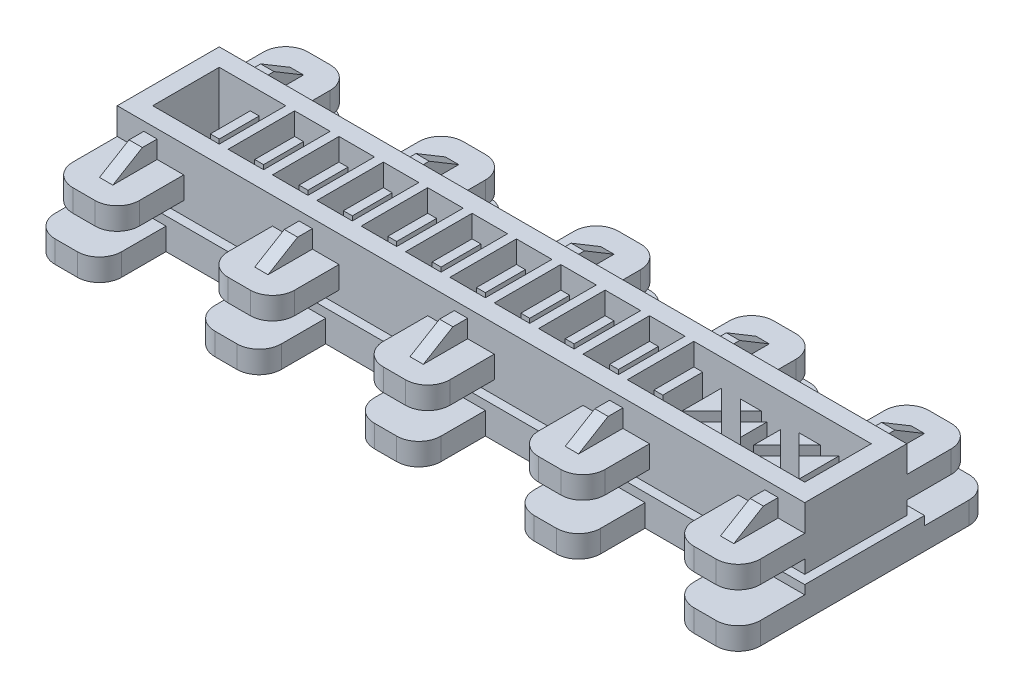
from build123d import *
from OCP.BRepFilletAPI import BRepFilletAPI_MakeChamfer

# Parameters (mm, degrees)
SKETCH1_W                       = 8
SKETCH1_H                       = 15
FIRST_CHAMBER_BLOCK_DEPTH       = 15
SKETCH2_W                       = 2
SKETCH2_H                       = 9
FIRST_CHAMBER_CAVITY_DEPTH      = 13
SKETCH3_W                       = 15
SKETCH3_H                       = 3
CHAMBER_SPACER_DEPTH            = 2
PATTERN_CHAMBERS_COUNT          = 11
PATTERN_CHAMBERS_PITCH          = 10
SKETCH4_W                       = 15
SKETCH4_H                       = 12
THICKEN_END_1_DEPTH             = 2
SKETCH5_W                       = 15
SKETCH5_H                       = 15
THICKEN_END_2_DEPTH             = 2
SKETCH6_W                       = 98
SKETCH6_H                       = 2
CENTRAL_AIR_CHANNEL_DEPTH       = 2
SKETCH17_W                      = 15
SKETCH17_H                      = 15
BOSS_EXTRUDE1_DEPTH             = 30
SKETCH18_W                      = 15
SKETCH18_H                      = 15
BOSS_EXTRUDE2_DEPTH             = 5
CUT_EXTRUDE1_DEPTH              = 12
SKETCH20_W                      = 6
SKETCH20_H                      = 2
SKETCH20_W_2                    = 3.257359313
SKETCH20_R                      = 1
NIPPLE_EXTRUDE_DEPTH            = 2
SKETCH10_W                      = 155
SKETCH10_H                      = 23
ENCASING_BLOCK_DEPTH            = 21
SPLIT_MOLD_OUTLINE_W            = 155
SPLIT_MOLD_OUTLINE_H            = 23
SPLIT_MOLD_OUTLINE_W_2          = 147
SPLIT_MOLD_OUTLINE_H_2          = 15
SPLIT_MOLD_DEPTH                = 15
SPLIT_START                     = 3
SPLIT_MOLD_2_OUTLINE_W          = 2
SPLIT_MOLD_2_OUTLINE_H          = 15
SPLIT_MOLD_2_DEPTH              = 12
SPLIT_MOLD_3_OUTLINE_W          = 155
SPLIT_MOLD_3_OUTLINE_H          = 23
SPLIT_MOLD_3_OUTLINE_W_2        = 147
SPLIT_MOLD_3_OUTLINE_H_2        = 15
SPLIT_MOLD_3_DEPTH              = 15
SPLIT_MOLD_4_OUTLINE_W          = 2
SPLIT_MOLD_4_OUTLINE_H          = 15
SPLIT_MOLD_4_DEPTH              = 12
SKETCH11_W                      = 15
SKETCH11_H                      = 5
GRIP_TAB_1_DEPTH                = 15
VERRUNDUNG1_R                   = 5
SKETCH13_W                      = 159
SKETCH13_H                      = 27
SKETCH13_W_2                    = 155
SKETCH13_H_2                    = 23
BASE_MOLD_LIP_DEPTH             = 7
SKETCH14_W                      = 15
SKETCH14_H                      = 5
BASE_GRIP_TABS_1_AND_2_DEPTH    = 15
SKETCH16_W                      = 15
SKETCH16_H                      = 5
BASE_GRIP_TABS_3_AND_4_DEPTH    = 15
FILLET_BASE_GRIP_TABS_R         = 5
SKIZZE1_W                       = 3
SKIZZE1_H                       = 6
AUFSATZ_LINEAR_AUSTRAGEN1_DEPTH = 10
FASE1_SIZE                      = 10
FASE1_SIZE_2                    = 6
FASE2_SIZE                      = 10
FASE2_SIZE_2                    = 6
SKIZZE2_W                       = 5
SKIZZE2_H                       = 2
SCHNITT_LINEAR_AUSTRAGEN1_DEPTH = 162.77144371


# Read off the part's stored shape, not the designer's step: split mold
with BuildPart() as part:
    # Sketch1 → first chamber block (new body)
    with BuildSketch(Plane.XY):
        with Locations((4, 7.5)):
            Rectangle(SKETCH1_W, SKETCH1_H)
    extrude(amount=FIRST_CHAMBER_BLOCK_DEPTH)

    # Sketch2 → first chamber cavity (cut)
    with BuildSketch(Plane.XZ):
        with Locations((4, 7.5)):
            Rectangle(SKETCH2_W, SKETCH2_H)
    extrude(amount=-FIRST_CHAMBER_CAVITY_DEPTH, mode=Mode.SUBTRACT)

    # Sketch3 → chamber spacer (add)
    with BuildSketch(Plane(origin=(8, 0, 0), x_dir=(0, 0, -1), z_dir=(1, 0, 0))):
        with Locations((-7.5, 1.5)):
            Rectangle(SKETCH3_W, SKETCH3_H)
    extrude(amount=CHAMBER_SPACER_DEPTH)


with BuildPart() as pattern_chambers_1:
    # pattern chambers: pattern copy
    add(part.part.moved(Location(Vector(1, 0, 0) * (1 * PATTERN_CHAMBERS_PITCH))))


with BuildPart() as pattern_chambers_2:
    # pattern chambers: pattern copy
    add(part.part.moved(Location(Vector(1, 0, 0) * (2 * PATTERN_CHAMBERS_PITCH))))


with BuildPart() as pattern_chambers_3:
    # pattern chambers: pattern copy
    add(part.part.moved(Location(Vector(1, 0, 0) * (3 * PATTERN_CHAMBERS_PITCH))))


with BuildPart() as pattern_chambers_4:
    # pattern chambers: pattern copy
    add(part.part.moved(Location(Vector(1, 0, 0) * (4 * PATTERN_CHAMBERS_PITCH))))


with BuildPart() as pattern_chambers_5:
    # pattern chambers: pattern copy
    add(part.part.moved(Location(Vector(1, 0, 0) * (5 * PATTERN_CHAMBERS_PITCH))))


with BuildPart() as pattern_chambers_6:
    # pattern chambers: pattern copy
    add(part.part.moved(Location(Vector(1, 0, 0) * (6 * PATTERN_CHAMBERS_PITCH))))


with BuildPart() as pattern_chambers_7:
    # pattern chambers: pattern copy
    add(part.part.moved(Location(Vector(1, 0, 0) * (7 * PATTERN_CHAMBERS_PITCH))))


with BuildPart() as pattern_chambers_8:
    # pattern chambers: pattern copy
    add(part.part.moved(Location(Vector(1, 0, 0) * (8 * PATTERN_CHAMBERS_PITCH))))


with BuildPart() as pattern_chambers_9:
    # pattern chambers: pattern copy
    add(part.part.moved(Location(Vector(1, 0, 0) * (9 * PATTERN_CHAMBERS_PITCH))))


with BuildPart() as pattern_chambers_10:
    # pattern chambers: pattern copy
    add(part.part.moved(Location(Vector(1, 0, 0) * (10 * PATTERN_CHAMBERS_PITCH))))

    # combine into 1 solid body: union pattern chambers_9, pattern chambers_8, pattern chambers_7, pattern chambers_6, pattern chambers_5, pattern chambers_4, pattern chambers_3, pattern chambers_2, pattern chambers_1, part
    add(pattern_chambers_9.part)
    add(pattern_chambers_8.part)
    add(pattern_chambers_7.part)
    add(pattern_chambers_6.part)
    add(pattern_chambers_5.part)
    add(pattern_chambers_4.part)
    add(pattern_chambers_3.part)
    add(pattern_chambers_2.part)
    add(pattern_chambers_1.part)
    add(part.part)

    # Sketch4 → thicken end 1 (add)
    with BuildSketch(Plane(origin=(108, 0, 0), x_dir=(0, 0, -1), z_dir=(1, 0, 0))):
        with Locations((-7.5, 9)):
            Rectangle(SKETCH4_W, SKETCH4_H)
    extrude(amount=THICKEN_END_1_DEPTH)

    # Sketch5 → thicken end 2 (add)
    with BuildSketch(Plane.ZY):
        with Locations((7.5, 7.5)):
            Rectangle(SKETCH5_W, SKETCH5_H)
    extrude(amount=THICKEN_END_2_DEPTH)

    # Sketch6 → central air channel (cut)
    with BuildSketch(Plane.XZ):
        with Locations((54, 7.5)):
            Rectangle(SKETCH6_W, SKETCH6_H)
    extrude(amount=-CENTRAL_AIR_CHANNEL_DEPTH, mode=Mode.SUBTRACT)

    # Sketch17 → Boss-Extrude1 (add)
    with BuildSketch(Plane(origin=(110, 0, 0), x_dir=(0, 0, -1), z_dir=(1, 0, 0))):
        with Locations((-7.5, 7.5)):
            Rectangle(SKETCH17_W, SKETCH17_H)
    extrude(amount=BOSS_EXTRUDE1_DEPTH)

    # Sketch18 → Boss-Extrude2 (add)
    with BuildSketch(Plane.ZY.offset(2)):
        with Locations((7.5, 7.5)):
            Rectangle(SKETCH18_W, SKETCH18_H)
    extrude(amount=BOSS_EXTRUDE2_DEPTH)

    # Sketch19 → Cut-Extrude1 (cut)
    with BuildSketch(Plane.XZ):
        Polygon((131.242640687, 7.5), (135.742640687, 3), (135.742640687, 12), align=None)
        Polygon((126.742640687, 3), (131.5, 3), (129.121320344, 5.378679656), align=None)
        Polygon((129.121320344, 9.621320344), (131.5, 12), (126.742640687, 12), align=None)
        Polygon((113.5, 3), (118.257359313, 3), (115.878679656, 5.378679656), align=None)
        Polygon((118, 7.5), (121, 4.5), (121, 10.5), align=None)
        Polygon((124, 10.5), (124, 4.5), (127, 7.5), align=None)
        Polygon((115.878679656, 9.621320344), (118.257359313, 12), (113.5, 12), align=None)
        Polygon((109.257359313, 12), (109.257359313, 3), (113.757359313, 7.5), align=None)
    extrude(amount=-CUT_EXTRUDE1_DEPTH, mode=Mode.SUBTRACT)

    # Sketch20 → nipple_extrude (add)
    with BuildSketch(Plane.XZ):
        Polygon((-6, 13), (-5, 13), (5, 13), (15, 13), (25, 13), (35, 13), (45, 13), (55, 13), (65, 13), (75, 13), (85, 13), (128, 13), (138, 13), (139, 13), (139, 14), (-6, 14), align=None)
        Polygon((-5, 2), (-5, 13), (-6, 13), (-6, 1), (139, 1), (139, 13), (138, 13), (138, 2), align=None)
        with Locations((-1, 10.5)):
            Rectangle(SKETCH20_W, SKETCH20_H)
        with Locations((-1, 4.5)):
            Rectangle(SKETCH20_W, SKETCH20_H)
        with Locations((9, 10.5)):
            Rectangle(SKETCH20_W, SKETCH20_H)
        with Locations((9, 4.5)):
            Rectangle(SKETCH20_W, SKETCH20_H)
        with Locations((19, 10.5)):
            Rectangle(SKETCH20_W, SKETCH20_H)
        with Locations((19, 4.5)):
            Rectangle(SKETCH20_W, SKETCH20_H)
        with Locations((29, 4.5)):
            Rectangle(SKETCH20_W, SKETCH20_H)
        with Locations((29, 10.5)):
            Rectangle(SKETCH20_W, SKETCH20_H)
        with Locations((39, 10.5)):
            Rectangle(SKETCH20_W, SKETCH20_H)
        with Locations((39, 4.5)):
            Rectangle(SKETCH20_W, SKETCH20_H)
        with Locations((49, 10.5)):
            Rectangle(SKETCH20_W, SKETCH20_H)
        with Locations((49, 4.5)):
            Rectangle(SKETCH20_W, SKETCH20_H)
        with Locations((59, 4.5)):
            Rectangle(SKETCH20_W, SKETCH20_H)
        with Locations((59, 10.5)):
            Rectangle(SKETCH20_W, SKETCH20_H)
        with Locations((69, 10.5)):
            Rectangle(SKETCH20_W, SKETCH20_H)
        with Locations((69, 4.5)):
            Rectangle(SKETCH20_W, SKETCH20_H)
        with Locations((79, 10.5)):
            Rectangle(SKETCH20_W, SKETCH20_H)
        with Locations((79, 4.5)):
            Rectangle(SKETCH20_W, SKETCH20_H)
        with Locations((89, 10.5)):
            Rectangle(SKETCH20_W, SKETCH20_H)
        with Locations((89, 4.5)):
            Rectangle(SKETCH20_W, SKETCH20_H)
        with Locations((99, 10.5)):
            Rectangle(SKETCH20_W, SKETCH20_H)
        with Locations((99, 4.5)):
            Rectangle(SKETCH20_W, SKETCH20_H)
        with Locations((107.128679656, 4.5)):
            Rectangle(SKETCH20_W_2, SKETCH20_H)
        with Locations((107.128679656, 10.5)):
            Rectangle(SKETCH20_W_2, SKETCH20_H)
        with Locations(Location((115.878679656, 7.5, 0), (0, 0, 90))):
            Circle(SKETCH20_R)
        with Locations(Location((129.121320344, 7.5, 0), (0, 0, 90))):
            Circle(SKETCH20_R)
    extrude(amount=NIPPLE_EXTRUDE_DEPTH)


with BuildPart() as body_2:
    # Sketch10 → encasing block (new body)
    with BuildSketch(Plane(origin=(0, 15, 0), x_dir=(1, 0, 0), z_dir=(0, 1, 0))):
        with Locations((66.5, -7.5)):
            Rectangle(SKETCH10_W, SKETCH10_H)
    extrude(amount=-ENCASING_BLOCK_DEPTH)

    # subtract actuator: cut pattern chambers_10
    add(pattern_chambers_10.part, mode=Mode.SUBTRACT)

    # split mold 3 outline → split mold 3 (cut)
    with BuildSketch(Plane(origin=(0, 0, 0), x_dir=(1, 0, 0), z_dir=(0, 1, 0))):
        with Locations((66.5, -7.5)):
            Rectangle(SPLIT_MOLD_3_OUTLINE_W, SPLIT_MOLD_3_OUTLINE_H)
        with Locations((66.5, -7.5)):
            Rectangle(SPLIT_MOLD_3_OUTLINE_W_2, SPLIT_MOLD_3_OUTLINE_H_2, mode=Mode.SUBTRACT)
    extrude(amount=SPLIT_MOLD_3_DEPTH, mode=Mode.SUBTRACT)

    # split mold 4 outline → split mold 4 (cut)
    with BuildSketch(Plane(origin=(0, 0, 0), x_dir=(1, 0, 0), z_dir=(0, 1, 0)).offset(SPLIT_START)):
        with Locations((99, -7.5)):
            Rectangle(SPLIT_MOLD_4_OUTLINE_W, SPLIT_MOLD_4_OUTLINE_H)
        with Locations((89, -7.5)):
            Rectangle(SPLIT_MOLD_4_OUTLINE_W, SPLIT_MOLD_4_OUTLINE_H)
        with Locations((79, -7.5)):
            Rectangle(SPLIT_MOLD_4_OUTLINE_W, SPLIT_MOLD_4_OUTLINE_H)
        with Locations((69, -7.5)):
            Rectangle(SPLIT_MOLD_4_OUTLINE_W, SPLIT_MOLD_4_OUTLINE_H)
        with Locations((59, -7.5)):
            Rectangle(SPLIT_MOLD_4_OUTLINE_W, SPLIT_MOLD_4_OUTLINE_H)
        with Locations((49, -7.5)):
            Rectangle(SPLIT_MOLD_4_OUTLINE_W, SPLIT_MOLD_4_OUTLINE_H)
        with Locations((39, -7.5)):
            Rectangle(SPLIT_MOLD_4_OUTLINE_W, SPLIT_MOLD_4_OUTLINE_H)
        with Locations((29, -7.5)):
            Rectangle(SPLIT_MOLD_4_OUTLINE_W, SPLIT_MOLD_4_OUTLINE_H)
        with Locations((19, -7.5)):
            Rectangle(SPLIT_MOLD_4_OUTLINE_W, SPLIT_MOLD_4_OUTLINE_H)
        with Locations((9, -7.5)):
            Rectangle(SPLIT_MOLD_4_OUTLINE_W, SPLIT_MOLD_4_OUTLINE_H)
    extrude(amount=SPLIT_MOLD_4_DEPTH, mode=Mode.SUBTRACT)

    # Sketch13 → base mold lip (add)
    with BuildSketch(Plane.XZ.offset(6)):
        with Locations((66.5, 7.5)):
            Rectangle(SKETCH13_W, SKETCH13_H)
        with Locations((66.5, 7.5)):
            Rectangle(SKETCH13_W_2, SKETCH13_H_2, mode=Mode.SUBTRACT)
    extrude(amount=-BASE_MOLD_LIP_DEPTH)

    # Sketch14 → base grip tabs 1 and 2 (add)
    with BuildSketch(Plane.XY.offset(21)):
        with Locations((-5.5, -3.5)):
            Rectangle(SKETCH14_W, SKETCH14_H)
        with Locations((138.5, -3.5)):
            Rectangle(SKETCH14_W, SKETCH14_H)
        with Locations((66.5, -3.5)):
            Rectangle(SKETCH14_W, SKETCH14_H)
        with Locations((102.5, -3.5)):
            Rectangle(SKETCH14_W, SKETCH14_H)
        with Locations((30.5, -3.5)):
            Rectangle(SKETCH14_W, SKETCH14_H)
    extrude(amount=BASE_GRIP_TABS_1_AND_2_DEPTH)

    # Sketch16 → base grip tabs 3 and 4 (add)
    with BuildSketch(Plane(origin=(0, 0, -6), x_dir=(-1, 0, 0), z_dir=(0, 0, -1))):
        with Locations((-138.5, -3.5)):
            Rectangle(SKETCH16_W, SKETCH16_H)
        with Locations((5.5, -3.5)):
            Rectangle(SKETCH16_W, SKETCH16_H)
        with Locations((-66.5, -3.5)):
            Rectangle(SKETCH16_W, SKETCH16_H)
        with Locations((-102.5, -3.5)):
            Rectangle(SKETCH16_W, SKETCH16_H)
        with Locations((-30.5, -3.5)):
            Rectangle(SKETCH16_W, SKETCH16_H)
    extrude(amount=BASE_GRIP_TABS_3_AND_4_DEPTH)

    # fillet base grip tabs
    fillet_base_grip_tabs_edges = [body_2.edges().sort_by_distance(p)[0] for p in [
        (146, -3.5, -21),
        (131, -3.5, -21),
        (2, -3.5, -21),
        (-13, -3.5, -21),
        (146, -3.5, 36),
        (131, -3.5, 36),
        (2, -3.5, 36),
        (-13, -3.5, 36),
        (59, -3.5, 36),
        (74, -3.5, 36),
        (59, -3.5, -21),
        (74, -3.5, -21),
        (95, -3.5, 36),
        (110, -3.5, 36),
        (23, -3.5, 36),
        (38, -3.5, 36),
        (23, -3.5, -21),
        (38, -3.5, -21),
        (95, -3.5, -21),
        (110, -3.5, -21),
    ]]
    fillet(fillet_base_grip_tabs_edges, radius=FILLET_BASE_GRIP_TABS_R)


with BuildPart() as body_2_2:
    # split mold outline → split mold (new body)
    with BuildSketch(Plane(origin=(0, 0, 0), x_dir=(1, 0, 0), z_dir=(0, 1, 0))):
        with Locations((66.5, -7.5)):
            Rectangle(SPLIT_MOLD_OUTLINE_W, SPLIT_MOLD_OUTLINE_H)
        with Locations((66.5, -7.5)):
            Rectangle(SPLIT_MOLD_OUTLINE_W_2, SPLIT_MOLD_OUTLINE_H_2, mode=Mode.SUBTRACT)
    extrude(amount=SPLIT_MOLD_DEPTH)

    # split mold 2 outline → split mold 2 (add)
    with BuildSketch(Plane(origin=(0, 0, 0), x_dir=(1, 0, 0), z_dir=(0, 1, 0)).offset(SPLIT_START)):
        with Locations((99, -7.5)):
            Rectangle(SPLIT_MOLD_2_OUTLINE_W, SPLIT_MOLD_2_OUTLINE_H)
        with Locations((89, -7.5)):
            Rectangle(SPLIT_MOLD_2_OUTLINE_W, SPLIT_MOLD_2_OUTLINE_H)
        with Locations((79, -7.5)):
            Rectangle(SPLIT_MOLD_2_OUTLINE_W, SPLIT_MOLD_2_OUTLINE_H)
        with Locations((69, -7.5)):
            Rectangle(SPLIT_MOLD_2_OUTLINE_W, SPLIT_MOLD_2_OUTLINE_H)
        with Locations((59, -7.5)):
            Rectangle(SPLIT_MOLD_2_OUTLINE_W, SPLIT_MOLD_2_OUTLINE_H)
        with Locations((49, -7.5)):
            Rectangle(SPLIT_MOLD_2_OUTLINE_W, SPLIT_MOLD_2_OUTLINE_H)
        with Locations((39, -7.5)):
            Rectangle(SPLIT_MOLD_2_OUTLINE_W, SPLIT_MOLD_2_OUTLINE_H)
        with Locations((29, -7.5)):
            Rectangle(SPLIT_MOLD_2_OUTLINE_W, SPLIT_MOLD_2_OUTLINE_H)
        with Locations((19, -7.5)):
            Rectangle(SPLIT_MOLD_2_OUTLINE_W, SPLIT_MOLD_2_OUTLINE_H)
        with Locations((9, -7.5)):
            Rectangle(SPLIT_MOLD_2_OUTLINE_W, SPLIT_MOLD_2_OUTLINE_H)
    extrude(amount=SPLIT_MOLD_2_DEPTH)

    # Sketch11 → grip tab 1 (add)
    with BuildSketch(Plane.XY.offset(19)):
        with Locations((-3.5, 6.5)):
            Rectangle(SKETCH11_W, SKETCH11_H)
        with Locations((66.5, 6.5)):
            Rectangle(SKETCH11_W, SKETCH11_H)
        with Locations((136.5, 6.5)):
            Rectangle(SKETCH11_W, SKETCH11_H)
        with Locations((31.5, 6.5)):
            Rectangle(SKETCH11_W, SKETCH11_H)
        with Locations((101.5, 6.5)):
            Rectangle(SKETCH11_W, SKETCH11_H)
    grip_tab_1 = extrude(amount=GRIP_TAB_1_DEPTH)

    # Spiegeln1: grip tab 1 across plane
    add(grip_tab_1.mirror(Plane.XY.offset(7.5)))

    # Verrundung1
    verrundung1_edges = [body_2_2.edges().sort_by_distance(p)[0] for p in [
        (-11, 6.5, -19),
        (4, 6.5, -19),
        (59, 6.5, -19),
        (74, 6.5, -19),
        (129, 6.5, -19),
        (144, 6.5, -19),
        (144, 6.5, 34),
        (129, 6.5, 34),
        (74, 6.5, 34),
        (59, 6.5, 34),
        (4, 6.5, 34),
        (-11, 6.5, 34),
        (109, 6.5, -19),
        (39, 6.5, -19),
        (24, 6.5, -19),
        (94, 6.5, -19),
        (109, 6.5, 34),
        (94, 6.5, 34),
        (39, 6.5, 34),
        (24, 6.5, 34),
    ]]
    fillet(verrundung1_edges, radius=VERRUNDUNG1_R)

    # Skizze1 → Aufsatz-Linear austragen1 (add)
    with BuildSketch(Plane.XY.offset(19)):
        with Locations((-3.5, 12)):
            Rectangle(SKIZZE1_W, SKIZZE1_H)
        with Locations((66.5, 12)):
            Rectangle(SKIZZE1_W, SKIZZE1_H)
        with Locations((136.5, 12)):
            Rectangle(SKIZZE1_W, SKIZZE1_H)
        with Locations((101.5, 12)):
            Rectangle(SKIZZE1_W, SKIZZE1_H)
        with Locations((31.5, 12)):
            Rectangle(SKIZZE1_W, SKIZZE1_H)
    aufsatz_linear_austragen1 = extrude(amount=AUFSATZ_LINEAR_AUSTRAGEN1_DEPTH)

    # Spiegeln2: Aufsatz-Linear austragen1 across plane
    add(aufsatz_linear_austragen1.mirror(Plane.XY.offset(7.5)))

    # Fase1
    fase1_edges_1 = [body_2_2.edges().sort_by_distance(p)[0] for p in [
        (-3.5, 15, 29),
    ]]
    fase1_side_1 = [body_2_2.faces().sort_by_distance(p)[0] for p in [
        (-3.5, 15, 28.88),
    ]]
    fase1_edges_2 = [body_2_2.edges().sort_by_distance(p)[0] for p in [
        (136.5, 15, 29),
    ]]
    fase1_side_2 = [body_2_2.faces().sort_by_distance(p)[0] for p in [
        (136.5, 15, 28.88),
    ]]
    fase1_edges_3 = [body_2_2.edges().sort_by_distance(p)[0] for p in [
        (66.5, 15, 29),
    ]]
    fase1_side_3 = [body_2_2.faces().sort_by_distance(p)[0] for p in [
        (66.5, 15, 28.88),
    ]]
    fase1_edges_4 = [body_2_2.edges().sort_by_distance(p)[0] for p in [
        (101.5, 15, 29),
    ]]
    fase1_side_4 = [body_2_2.faces().sort_by_distance(p)[0] for p in [
        (101.5, 15, 28.88),
    ]]
    fase1_edges_5 = [body_2_2.edges().sort_by_distance(p)[0] for p in [
        (31.5, 15, 29),
    ]]
    fase1_side_5 = [body_2_2.faces().sort_by_distance(p)[0] for p in [
        (31.5, 15, 28.88),
    ]]
    fase1 = BRepFilletAPI_MakeChamfer(body_2_2.part.solid().wrapped)
    for e in fase1_edges_1:
        fase1.Add(FASE1_SIZE - 0.0001, FASE1_SIZE_2 - 0.0001, e.wrapped, fase1_side_1[0].wrapped)
    for e in fase1_edges_2:
        fase1.Add(FASE1_SIZE - 0.0001, FASE1_SIZE_2 - 0.0001, e.wrapped, fase1_side_2[0].wrapped)
    for e in fase1_edges_3:
        fase1.Add(FASE1_SIZE - 0.0001, FASE1_SIZE_2 - 0.0001, e.wrapped, fase1_side_3[0].wrapped)
    for e in fase1_edges_4:
        fase1.Add(FASE1_SIZE - 0.0001, FASE1_SIZE_2 - 0.0001, e.wrapped, fase1_side_4[0].wrapped)
    for e in fase1_edges_5:
        fase1.Add(FASE1_SIZE - 0.0001, FASE1_SIZE_2 - 0.0001, e.wrapped, fase1_side_5[0].wrapped)
    add(Compound.cast(fase1.Shape()), mode=Mode.REPLACE)  # a hair under: the kernel refuses the full size

    # Fase2
    fase2_edges_1 = [body_2_2.edges().sort_by_distance(p)[0] for p in [
        (136.5, 15, -14),
    ]]
    fase2_side_1 = [body_2_2.faces().sort_by_distance(p)[0] for p in [
        (136.5, 15, -13.88),
    ]]
    fase2_edges_2 = [body_2_2.edges().sort_by_distance(p)[0] for p in [
        (66.5, 15, -14),
    ]]
    fase2_side_2 = [body_2_2.faces().sort_by_distance(p)[0] for p in [
        (66.5, 15, -13.88),
    ]]
    fase2_edges_3 = [body_2_2.edges().sort_by_distance(p)[0] for p in [
        (-3.5, 15, -14),
    ]]
    fase2_side_3 = [body_2_2.faces().sort_by_distance(p)[0] for p in [
        (-3.5, 15, -13.88),
    ]]
    fase2_edges_4 = [body_2_2.edges().sort_by_distance(p)[0] for p in [
        (101.5, 15, -14),
    ]]
    fase2_side_4 = [body_2_2.faces().sort_by_distance(p)[0] for p in [
        (101.5, 15, -13.88),
    ]]
    fase2_edges_5 = [body_2_2.edges().sort_by_distance(p)[0] for p in [
        (31.5, 15, -14),
    ]]
    fase2_side_5 = [body_2_2.faces().sort_by_distance(p)[0] for p in [
        (31.5, 15, -13.88),
    ]]
    fase2 = BRepFilletAPI_MakeChamfer(body_2_2.part.solid().wrapped)
    for e in fase2_edges_1:
        fase2.Add(FASE2_SIZE - 0.0001, FASE2_SIZE_2 - 0.0001, e.wrapped, fase2_side_1[0].wrapped)
    for e in fase2_edges_2:
        fase2.Add(FASE2_SIZE - 0.0001, FASE2_SIZE_2 - 0.0001, e.wrapped, fase2_side_2[0].wrapped)
    for e in fase2_edges_3:
        fase2.Add(FASE2_SIZE - 0.0001, FASE2_SIZE_2 - 0.0001, e.wrapped, fase2_side_3[0].wrapped)
    for e in fase2_edges_4:
        fase2.Add(FASE2_SIZE - 0.0001, FASE2_SIZE_2 - 0.0001, e.wrapped, fase2_side_4[0].wrapped)
    for e in fase2_edges_5:
        fase2.Add(FASE2_SIZE - 0.0001, FASE2_SIZE_2 - 0.0001, e.wrapped, fase2_side_5[0].wrapped)
    add(Compound.cast(fase2.Shape()), mode=Mode.REPLACE)  # a hair under: the kernel refuses the full size

    # Skizze2 → Schnitt-Linear austragen1 (cut, through all)
    with BuildSketch(Plane(origin=(144, 0, 0), x_dir=(0, 0, -1), z_dir=(1, 0, 0))):
        with Locations((6.5, 14)):
            Rectangle(SKIZZE2_W, SKIZZE2_H)
        with Locations((-21.5, 14)):
            Rectangle(SKIZZE2_W, SKIZZE2_H)
    extrude(amount=-SCHNITT_LINEAR_AUSTRAGEN1_DEPTH, mode=Mode.SUBTRACT)


solid = Compound([body_2.part, body_2_2.part])
